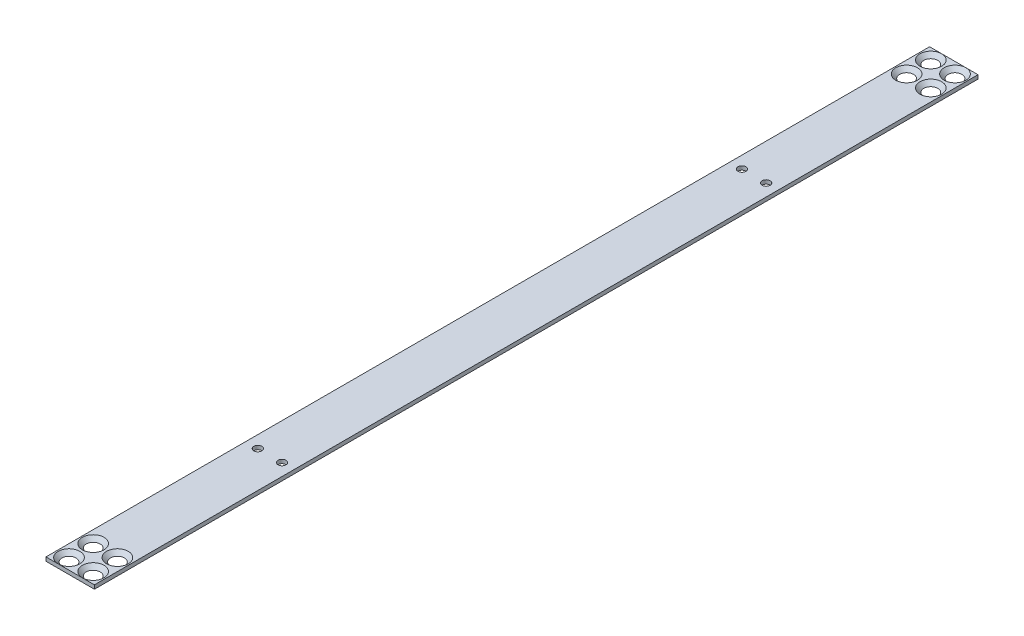
from build123d import *

# Parameters (mm, degrees)
SKETCH1_W                    = 20
SKETCH1_H                    = 365
BOSS_EXTRUDE1_DEPTH          = 1.5875
CSK_FOR_M4_SFHCS1_AT_2_COUNT = 2
CSK_FOR_M4_SFHCS1_AT_2_PITCH = 14.142135624
CSK_FOR_M4_SFHCS1_AT_3_COUNT = 2
CSK_FOR_M4_SFHCS1_AT_3_PITCH = 10
CSK_FOR_M4_SFHCS1_AT_4_COUNT = 2
CSK_FOR_M4_SFHCS1_AT_4_PITCH = 10
CSK_FOR_M4_SFHCS1_AT_5_COUNT = 2
CSK_FOR_M4_SFHCS1_AT_5_PITCH = 346
CSK_FOR_M4_SFHCS1_AT_6_COUNT = 2
CSK_FOR_M4_SFHCS1_AT_6_PITCH = 336.148776586
CSK_FOR_M4_SFHCS1_AT_7_COUNT = 2
CSK_FOR_M4_SFHCS1_AT_7_PITCH = 346.144478506
CSK_FOR_M4_SFHCS1_AT_8_COUNT = 2
CSK_FOR_M4_SFHCS1_AT_8_PITCH = 336
M4X0_7_TAPPED_HOLE1_D        = 3.3


with BuildPart() as part:
    # Sketch1 → Boss-Extrude1 (new body)
    with BuildSketch(Plane(origin=(0, 0, 0), x_dir=(1, 0, 0), z_dir=(0, 1, 0))):
        Rectangle(SKETCH1_W, SKETCH1_H)
    extrude(amount=BOSS_EXTRUDE1_DEPTH)

    # Sketch3 → CSK for M4 SFHCS1 (revolve, cut)
    with BuildSketch(Plane(origin=(5, 1.5875, 168), x_dir=(0, 0, 1), z_dir=(1, 0, 0))):
        Polygon((0, 0), (0, 1.5875), (2.25, 1.5875), (2.25, 2.23), (4.48, 0), align=None)
    csk_for_m4_sfhcs1 = revolve(axis=Axis((5, 7.9375, 168), (0, -1, 0)), mode=Mode.SUBTRACT)

    # CSK for M4 SFHCS1 at 2: CSK for M4 SFHCS1 ×2
    with Locations(*[Vector(-0.7071067811865469, 0, 0.7071067811865482) * (i * CSK_FOR_M4_SFHCS1_AT_2_PITCH) for i in range(1, CSK_FOR_M4_SFHCS1_AT_2_COUNT)]):
        add(csk_for_m4_sfhcs1, mode=Mode.SUBTRACT)

    # CSK for M4 SFHCS1 at 3: CSK for M4 SFHCS1 ×2
    with Locations(*[(-i * CSK_FOR_M4_SFHCS1_AT_3_PITCH, 0, 0) for i in range(1, CSK_FOR_M4_SFHCS1_AT_3_COUNT)]):
        add(csk_for_m4_sfhcs1, mode=Mode.SUBTRACT)

    # CSK for M4 SFHCS1 at 4: CSK for M4 SFHCS1 ×2
    with Locations(*[(0, 0, i * CSK_FOR_M4_SFHCS1_AT_4_PITCH) for i in range(1, CSK_FOR_M4_SFHCS1_AT_4_COUNT)]):
        add(csk_for_m4_sfhcs1, mode=Mode.SUBTRACT)

    # CSK for M4 SFHCS1 at 5: CSK for M4 SFHCS1 ×2
    with Locations(*[(0, 0, -i * CSK_FOR_M4_SFHCS1_AT_5_PITCH) for i in range(1, CSK_FOR_M4_SFHCS1_AT_5_COUNT)]):
        add(csk_for_m4_sfhcs1, mode=Mode.SUBTRACT)

    # CSK for M4 SFHCS1 at 6: CSK for M4 SFHCS1 ×2
    with Locations(*[Vector(-0.029748732396333223, 0, -0.9995574085167952) * (i * CSK_FOR_M4_SFHCS1_AT_6_PITCH) for i in range(1, CSK_FOR_M4_SFHCS1_AT_6_COUNT)]):
        add(csk_for_m4_sfhcs1, mode=Mode.SUBTRACT)

    # CSK for M4 SFHCS1 at 7: CSK for M4 SFHCS1 ×2
    with Locations(*[Vector(-0.028889670703889703, 0, -0.9995826063545828) * (i * CSK_FOR_M4_SFHCS1_AT_7_PITCH) for i in range(1, CSK_FOR_M4_SFHCS1_AT_7_COUNT)]):
        add(csk_for_m4_sfhcs1, mode=Mode.SUBTRACT)

    # CSK for M4 SFHCS1 at 8: CSK for M4 SFHCS1 ×2
    with Locations(*[(0, 0, -i * CSK_FOR_M4_SFHCS1_AT_8_PITCH) for i in range(1, CSK_FOR_M4_SFHCS1_AT_8_COUNT)]):
        add(csk_for_m4_sfhcs1, mode=Mode.SUBTRACT)

    # M4x0.7 Tapped Hole1 (through all)
    with Locations(Plane(origin=(0, 1.5875, 0), x_dir=(1, 0, 0), z_dir=(0, 1, 0))):
        with Locations((-5, -100), (-5, 100), (5, 100), (5, -100)):
            Hole(M4X0_7_TAPPED_HOLE1_D / 2)


solid = part.part
